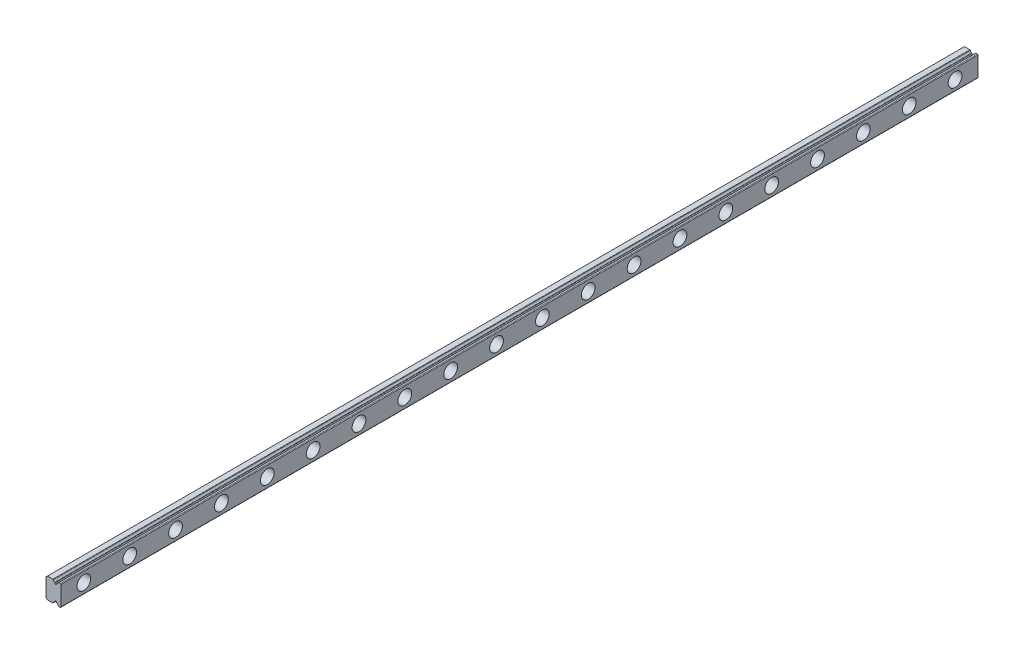
from build123d import *

# Parameters (mm, degrees)
EXTRUDE_1_DEPTH     = 400
SKETCH_2_R          = 3
CUT_EXTRUDE_1_DEPTH = 4.5
SKETCH_3_R          = 1.75
CUT_EXTRUDE_2_DEPTH = 401.126542484


with BuildPart() as part:
    # 草图1 → 凸台-拉伸1 (new body)
    with BuildSketch(Plane.XY):
        with BuildLine():
            Line((0.6, 9), (0, 8.4))
            Line((0, 8.4), (0, 0.6))
            Line((0, 0.6), (0.6, 0))
            Line((0.6, 0), (2.942330317, 0))
            ThreePointArc((2.942330317, 0), (3.055719659, 0.035249106), (3.129140272, 0.128571429))
            ThreePointArc((3.129140272, 0.128571429), (3.369153549, 0.514929157), (3.735714286, 0.784209483))
            ThreePointArc((3.735714286, 0.784209483), (3.819030851, 0.858006567), (3.85, 0.964911064))
            Line((3.85, 0.964911064), (3.85, 1))
            ThreePointArc((3.85, 1), (4.25, 1.4), (4.65, 1))
            Line((4.65, 1), (4.65, 0.964911064))
            ThreePointArc((4.65, 0.964911064), (4.680969149, 0.858006567), (4.764285714, 0.784209483))
            ThreePointArc((4.764285714, 0.784209483), (5.130846451, 0.514929157), (5.370859728, 0.128571429))
            ThreePointArc((5.370859728, 0.128571429), (5.444280341, 0.035249106), (5.557669683, 0))
            Line((5.557669683, 0), (6.2, 0))
            ThreePointArc((6.2, 0), (6.412132034, 0.087867966), (6.5, 0.3))
            Line((6.5, 0.3), (6.5, 8.7))
            ThreePointArc((6.5, 8.7), (6.412132034, 8.912132034), (6.2, 9))
            Line((6.2, 9), (5.557669683, 9))
            ThreePointArc((5.557669683, 9), (5.444280341, 8.964750894), (5.370859728, 8.871428571))
            ThreePointArc((5.370859728, 8.871428571), (5.130846451, 8.485070843), (4.764285714, 8.215790517))
            ThreePointArc((4.764285714, 8.215790517), (4.680969149, 8.141993433), (4.65, 8.035088936))
            Line((4.65, 8.035088936), (4.65, 8))
            ThreePointArc((4.65, 8), (4.25, 7.6), (3.85, 8))
            Line((3.85, 8), (3.85, 8.035088936))
            ThreePointArc((3.85, 8.035088936), (3.819030851, 8.141993433), (3.735714286, 8.215790517))
            ThreePointArc((3.735714286, 8.215790517), (3.369153549, 8.485070843), (3.129140272, 8.871428571))
            ThreePointArc((3.129140272, 8.871428571), (3.055719659, 8.964750894), (2.942330317, 9))
            Line((2.942330317, 9), (0.6, 9))
        make_face()
    extrude(amount=EXTRUDE_1_DEPTH)

    # 草图2 → 切除-拉伸1 (cut)
    with BuildSketch(Plane(origin=(6.5, 0, 0), x_dir=(0, 0, -1), z_dir=(1, 0, 0))):
        with Locations((-10, 4.5)):
            Circle(SKETCH_2_R)
        with Locations((-30, 4.5)):
            Circle(SKETCH_2_R)
        with Locations((-50, 4.5)):
            Circle(SKETCH_2_R)
        with Locations((-70, 4.5)):
            Circle(SKETCH_2_R)
        with Locations((-90, 4.5)):
            Circle(SKETCH_2_R)
        with Locations((-110, 4.5)):
            Circle(SKETCH_2_R)
        with Locations((-130, 4.5)):
            Circle(SKETCH_2_R)
        with Locations((-150, 4.5)):
            Circle(SKETCH_2_R)
        with Locations((-170, 4.5)):
            Circle(SKETCH_2_R)
        with Locations((-190, 4.5)):
            Circle(SKETCH_2_R)
        with Locations((-210, 4.5)):
            Circle(SKETCH_2_R)
        with Locations((-230, 4.5)):
            Circle(SKETCH_2_R)
        with Locations((-250, 4.5)):
            Circle(SKETCH_2_R)
        with Locations((-270, 4.5)):
            Circle(SKETCH_2_R)
        with Locations((-290, 4.5)):
            Circle(SKETCH_2_R)
        with Locations((-310, 4.5)):
            Circle(SKETCH_2_R)
        with Locations((-330, 4.5)):
            Circle(SKETCH_2_R)
        with Locations((-350, 4.5)):
            Circle(SKETCH_2_R)
        with Locations((-370, 4.5)):
            Circle(SKETCH_2_R)
        with Locations((-390, 4.5)):
            Circle(SKETCH_2_R)
        with Locations((-410, 4.5)):
            Circle(SKETCH_2_R)
        with Locations((-430, 4.5)):
            Circle(SKETCH_2_R)
        with Locations((-450, 4.5)):
            Circle(SKETCH_2_R)
        with Locations((-470, 4.5)):
            Circle(SKETCH_2_R)
        with Locations((-490, 4.5)):
            Circle(SKETCH_2_R)
        with Locations((-510, 4.5)):
            Circle(SKETCH_2_R)
        with Locations((-530, 4.5)):
            Circle(SKETCH_2_R)
        with Locations((-550, 4.5)):
            Circle(SKETCH_2_R)
        with Locations((-570, 4.5)):
            Circle(SKETCH_2_R)
        with Locations((-590, 4.5)):
            Circle(SKETCH_2_R)
        with Locations((-610, 4.5)):
            Circle(SKETCH_2_R)
        with Locations((-630, 4.5)):
            Circle(SKETCH_2_R)
        with Locations((-650, 4.5)):
            Circle(SKETCH_2_R)
        with Locations((-670, 4.5)):
            Circle(SKETCH_2_R)
        with Locations((-690, 4.5)):
            Circle(SKETCH_2_R)
        with Locations((-710, 4.5)):
            Circle(SKETCH_2_R)
        with Locations((-730, 4.5)):
            Circle(SKETCH_2_R)
        with Locations((-750, 4.5)):
            Circle(SKETCH_2_R)
        with Locations((-770, 4.5)):
            Circle(SKETCH_2_R)
        with Locations((-790, 4.5)):
            Circle(SKETCH_2_R)
        with Locations((-810, 4.5)):
            Circle(SKETCH_2_R)
        with Locations((-830, 4.5)):
            Circle(SKETCH_2_R)
        with Locations((-850, 4.5)):
            Circle(SKETCH_2_R)
        with Locations((-870, 4.5)):
            Circle(SKETCH_2_R)
        with Locations((-890, 4.5)):
            Circle(SKETCH_2_R)
        with Locations((-910, 4.5)):
            Circle(SKETCH_2_R)
        with Locations((-930, 4.5)):
            Circle(SKETCH_2_R)
        with Locations((-950, 4.5)):
            Circle(SKETCH_2_R)
        with Locations((-970, 4.5)):
            Circle(SKETCH_2_R)
        with Locations((-990, 4.5)):
            Circle(SKETCH_2_R)
        with Locations((-1010, 4.5)):
            Circle(SKETCH_2_R)
        with Locations((-1030, 4.5)):
            Circle(SKETCH_2_R)
        with Locations((-1050, 4.5)):
            Circle(SKETCH_2_R)
        with Locations((-1070, 4.5)):
            Circle(SKETCH_2_R)
        with Locations((-1090, 4.5)):
            Circle(SKETCH_2_R)
        with Locations((-1110, 4.5)):
            Circle(SKETCH_2_R)
        with Locations((-1130, 4.5)):
            Circle(SKETCH_2_R)
        with Locations((-1150, 4.5)):
            Circle(SKETCH_2_R)
        with Locations((-1170, 4.5)):
            Circle(SKETCH_2_R)
        with Locations((-1190, 4.5)):
            Circle(SKETCH_2_R)
        with Locations((-1210, 4.5)):
            Circle(SKETCH_2_R)
        with Locations((-1230, 4.5)):
            Circle(SKETCH_2_R)
        with Locations((-1250, 4.5)):
            Circle(SKETCH_2_R)
        with Locations((-1270, 4.5)):
            Circle(SKETCH_2_R)
        with Locations((-1290, 4.5)):
            Circle(SKETCH_2_R)
        with Locations((-1310, 4.5)):
            Circle(SKETCH_2_R)
        with Locations((-1330, 4.5)):
            Circle(SKETCH_2_R)
        with Locations((-1350, 4.5)):
            Circle(SKETCH_2_R)
        with Locations((-1370, 4.5)):
            Circle(SKETCH_2_R)
        with Locations((-1390, 4.5)):
            Circle(SKETCH_2_R)
        with Locations((-1410, 4.5)):
            Circle(SKETCH_2_R)
        with Locations((-1430, 4.5)):
            Circle(SKETCH_2_R)
        with Locations((-1450, 4.5)):
            Circle(SKETCH_2_R)
        with Locations((-1470, 4.5)):
            Circle(SKETCH_2_R)
        with Locations((-1490, 4.5)):
            Circle(SKETCH_2_R)
        with Locations((-1510, 4.5)):
            Circle(SKETCH_2_R)
        with Locations((-1530, 4.5)):
            Circle(SKETCH_2_R)
        with Locations((-1550, 4.5)):
            Circle(SKETCH_2_R)
        with Locations((-1570, 4.5)):
            Circle(SKETCH_2_R)
        with Locations((-1590, 4.5)):
            Circle(SKETCH_2_R)
        with Locations((-1610, 4.5)):
            Circle(SKETCH_2_R)
        with Locations((-1630, 4.5)):
            Circle(SKETCH_2_R)
        with Locations((-1650, 4.5)):
            Circle(SKETCH_2_R)
        with Locations((-1670, 4.5)):
            Circle(SKETCH_2_R)
        with Locations((-1690, 4.5)):
            Circle(SKETCH_2_R)
        with Locations((-1710, 4.5)):
            Circle(SKETCH_2_R)
        with Locations((-1730, 4.5)):
            Circle(SKETCH_2_R)
        with Locations((-1750, 4.5)):
            Circle(SKETCH_2_R)
        with Locations((-1770, 4.5)):
            Circle(SKETCH_2_R)
        with Locations((-1790, 4.5)):
            Circle(SKETCH_2_R)
        with Locations((-1810, 4.5)):
            Circle(SKETCH_2_R)
        with Locations((-1830, 4.5)):
            Circle(SKETCH_2_R)
        with Locations((-1850, 4.5)):
            Circle(SKETCH_2_R)
        with Locations((-1870, 4.5)):
            Circle(SKETCH_2_R)
        with Locations((-1890, 4.5)):
            Circle(SKETCH_2_R)
        with Locations((-1910, 4.5)):
            Circle(SKETCH_2_R)
        with Locations((-1930, 4.5)):
            Circle(SKETCH_2_R)
        with Locations((-1950, 4.5)):
            Circle(SKETCH_2_R)
        with Locations((-1970, 4.5)):
            Circle(SKETCH_2_R)
        with Locations((-1990, 4.5)):
            Circle(SKETCH_2_R)
        with Locations((-2010, 4.5)):
            Circle(SKETCH_2_R)
        with Locations((-2030, 4.5)):
            Circle(SKETCH_2_R)
        with Locations((-2050, 4.5)):
            Circle(SKETCH_2_R)
        with Locations((-2070, 4.5)):
            Circle(SKETCH_2_R)
        with Locations((-2090, 4.5)):
            Circle(SKETCH_2_R)
        with Locations((-2110, 4.5)):
            Circle(SKETCH_2_R)
        with Locations((-2130, 4.5)):
            Circle(SKETCH_2_R)
        with Locations((-2150, 4.5)):
            Circle(SKETCH_2_R)
        with Locations((-2170, 4.5)):
            Circle(SKETCH_2_R)
        with Locations((-2190, 4.5)):
            Circle(SKETCH_2_R)
        with Locations((-2210, 4.5)):
            Circle(SKETCH_2_R)
        with Locations((-2230, 4.5)):
            Circle(SKETCH_2_R)
        with Locations((-2250, 4.5)):
            Circle(SKETCH_2_R)
        with Locations((-2270, 4.5)):
            Circle(SKETCH_2_R)
        with Locations((-2290, 4.5)):
            Circle(SKETCH_2_R)
        with Locations((-2310, 4.5)):
            Circle(SKETCH_2_R)
        with Locations((-2330, 4.5)):
            Circle(SKETCH_2_R)
        with Locations((-2350, 4.5)):
            Circle(SKETCH_2_R)
        with Locations((-2370, 4.5)):
            Circle(SKETCH_2_R)
        with Locations((-2390, 4.5)):
            Circle(SKETCH_2_R)
        with Locations((-2410, 4.5)):
            Circle(SKETCH_2_R)
        with Locations((-2430, 4.5)):
            Circle(SKETCH_2_R)
        with Locations((-2450, 4.5)):
            Circle(SKETCH_2_R)
        with Locations((-2470, 4.5)):
            Circle(SKETCH_2_R)
    extrude(amount=-CUT_EXTRUDE_1_DEPTH, mode=Mode.SUBTRACT)

    # 草图3 → 切除-拉伸2 (cut, through all)
    with BuildSketch(Plane(origin=(2, 0, 0), x_dir=(0, 0, -1), z_dir=(1, 0, 0))):
        with Locations((-10, 4.5)):
            Circle(SKETCH_3_R)
        with Locations((-30, 4.5)):
            Circle(SKETCH_3_R)
        with Locations((-50, 4.5)):
            Circle(SKETCH_3_R)
        with Locations((-70, 4.5)):
            Circle(SKETCH_3_R)
        with Locations((-90, 4.5)):
            Circle(SKETCH_3_R)
        with Locations((-110, 4.5)):
            Circle(SKETCH_3_R)
        with Locations((-130, 4.5)):
            Circle(SKETCH_3_R)
        with Locations((-150, 4.5)):
            Circle(SKETCH_3_R)
        with Locations((-170, 4.5)):
            Circle(SKETCH_3_R)
        with Locations((-190, 4.5)):
            Circle(SKETCH_3_R)
        with Locations((-210, 4.5)):
            Circle(SKETCH_3_R)
        with Locations((-230, 4.5)):
            Circle(SKETCH_3_R)
        with Locations((-250, 4.5)):
            Circle(SKETCH_3_R)
        with Locations((-270, 4.5)):
            Circle(SKETCH_3_R)
        with Locations((-290, 4.5)):
            Circle(SKETCH_3_R)
        with Locations((-310, 4.5)):
            Circle(SKETCH_3_R)
        with Locations((-330, 4.5)):
            Circle(SKETCH_3_R)
        with Locations((-350, 4.5)):
            Circle(SKETCH_3_R)
        with Locations((-370, 4.5)):
            Circle(SKETCH_3_R)
        with Locations((-390, 4.5)):
            Circle(SKETCH_3_R)
        with Locations((-410, 4.5)):
            Circle(SKETCH_3_R)
        with Locations((-430, 4.5)):
            Circle(SKETCH_3_R)
        with Locations((-450, 4.5)):
            Circle(SKETCH_3_R)
        with Locations((-470, 4.5)):
            Circle(SKETCH_3_R)
        with Locations((-490, 4.5)):
            Circle(SKETCH_3_R)
        with Locations((-510, 4.5)):
            Circle(SKETCH_3_R)
        with Locations((-530, 4.5)):
            Circle(SKETCH_3_R)
        with Locations((-550, 4.5)):
            Circle(SKETCH_3_R)
        with Locations((-570, 4.5)):
            Circle(SKETCH_3_R)
        with Locations((-590, 4.5)):
            Circle(SKETCH_3_R)
        with Locations((-610, 4.5)):
            Circle(SKETCH_3_R)
        with Locations((-630, 4.5)):
            Circle(SKETCH_3_R)
        with Locations((-650, 4.5)):
            Circle(SKETCH_3_R)
        with Locations((-670, 4.5)):
            Circle(SKETCH_3_R)
        with Locations((-690, 4.5)):
            Circle(SKETCH_3_R)
        with Locations((-710, 4.5)):
            Circle(SKETCH_3_R)
        with Locations((-730, 4.5)):
            Circle(SKETCH_3_R)
        with Locations((-750, 4.5)):
            Circle(SKETCH_3_R)
        with Locations((-770, 4.5)):
            Circle(SKETCH_3_R)
        with Locations((-790, 4.5)):
            Circle(SKETCH_3_R)
        with Locations((-810, 4.5)):
            Circle(SKETCH_3_R)
        with Locations((-830, 4.5)):
            Circle(SKETCH_3_R)
        with Locations((-850, 4.5)):
            Circle(SKETCH_3_R)
        with Locations((-870, 4.5)):
            Circle(SKETCH_3_R)
        with Locations((-890, 4.5)):
            Circle(SKETCH_3_R)
        with Locations((-910, 4.5)):
            Circle(SKETCH_3_R)
        with Locations((-930, 4.5)):
            Circle(SKETCH_3_R)
        with Locations((-950, 4.5)):
            Circle(SKETCH_3_R)
        with Locations((-970, 4.5)):
            Circle(SKETCH_3_R)
        with Locations((-990, 4.5)):
            Circle(SKETCH_3_R)
        with Locations((-1010, 4.5)):
            Circle(SKETCH_3_R)
        with Locations((-1030, 4.5)):
            Circle(SKETCH_3_R)
        with Locations((-1050, 4.5)):
            Circle(SKETCH_3_R)
        with Locations((-1070, 4.5)):
            Circle(SKETCH_3_R)
    extrude(amount=-CUT_EXTRUDE_2_DEPTH, mode=Mode.SUBTRACT)


solid = part.part
